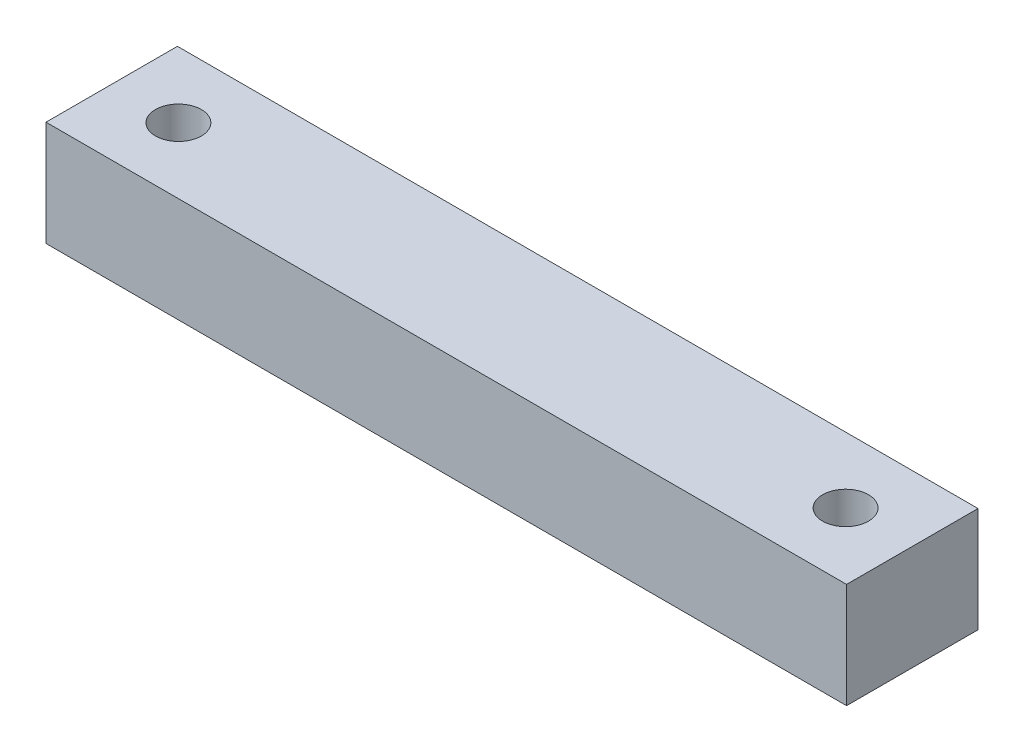
from build123d import *

# Parameters (mm, degrees)
BOSS_EXTRUDE2_OUTLINE_W = 304.8
BOSS_EXTRUDE2_OUTLINE_H = 50.038
BOSS_EXTRUDE2_DEPTH     = 39.99992
SKETCH3_R               = 4.7625
CUT_EXTRUDE1_DEPTH      = 312.459202856
SKETCH4_R               = 8.7376
CUT_EXTRUDE2_DEPTH      = 15.875


# Read off the part's stored shape, not the designer's step: Boss-Extrude2
with BuildPart() as part:
    # Boss-Extrude2 outline → Boss-Extrude2 (new body)
    with BuildSketch(Plane(origin=(0, 0, 0), x_dir=(1, 0, 0), z_dir=(0, 1, 0))):
        with Locations((152.4, 25.019)):
            Rectangle(BOSS_EXTRUDE2_OUTLINE_W, BOSS_EXTRUDE2_OUTLINE_H)
    extrude(amount=BOSS_EXTRUDE2_DEPTH)

    # Sketch3 → Cut-Extrude1 (cut, through all)
    with BuildSketch(Plane(origin=(0, 39.99992, 0), x_dir=(1, 0, 0), z_dir=(0, 1, 0))):
        with Locations(Location((279.4, 25.019, 0), (0, 0, 270))):
            Circle(SKETCH3_R)
        with Locations(Location((25.4, 25.019, 0), (0, 0, 270))):
            Circle(SKETCH3_R)
    extrude(amount=-CUT_EXTRUDE1_DEPTH, mode=Mode.SUBTRACT)

    # Sketch4 → Cut-Extrude2 (cut)
    with BuildSketch(Plane(origin=(0, 39.99992, 0), x_dir=(1, 0, 0), z_dir=(0, 1, 0))):
        with Locations(Location((279.4, 25.019, 0), (0, 0, 270))):
            Circle(SKETCH4_R)
        with Locations(Location((25.4, 25.019, 0), (0, 0, 270))):
            Circle(SKETCH4_R)
    extrude(amount=-CUT_EXTRUDE2_DEPTH, mode=Mode.SUBTRACT)


solid = part.part
